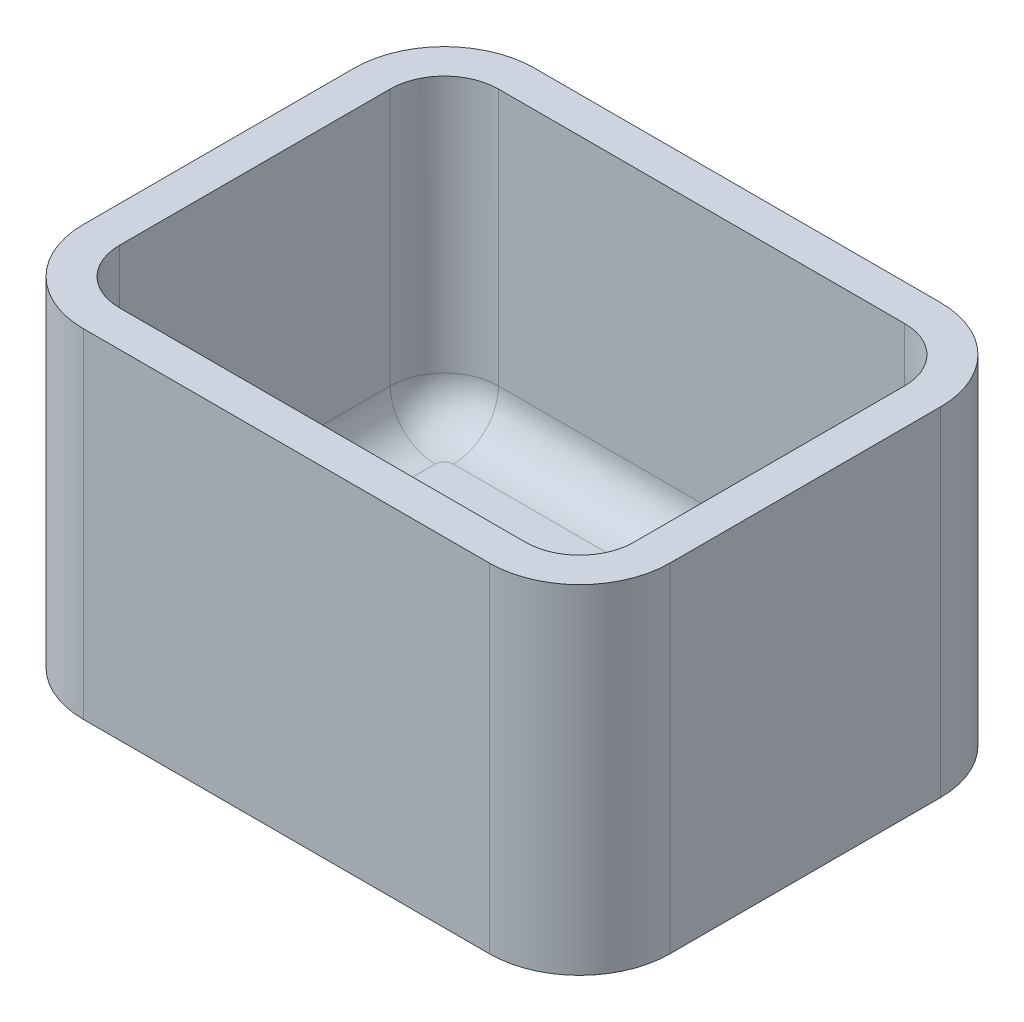
from build123d import *

# Parameters (mm, degrees)
ESQUISSE4_W             = 130
ESQUISSE4_H             = 100
BOSS_EXTRU_4_DEPTH      = 75
CONG_5_R                = 20
ENL_V_MAT_EXTRU_1_DEPTH = 67
CONG_6_SIZE             = 10


with BuildPart() as part:
    # Esquisse4 → Boss.-Extru.4 (new body)
    with BuildSketch(Plane(origin=(0, 0, 0), x_dir=(1, 0, 0), z_dir=(0, 1, 0))):
        with Locations((12.771948074, 16.229726537)):
            Rectangle(ESQUISSE4_W, ESQUISSE4_H)
    extrude(amount=BOSS_EXTRU_4_DEPTH)

    # Congé5
    cong_5_edges = [part.edges().sort_by_distance(p)[0] for p in [
        (-52.228051926, 37.5, -66.229726537),
        (77.771948074, 37.5, -66.229726537),
        (77.771948074, 37.5, 33.770273463),
        (-52.228051926, 37.5, 33.770273463),
    ]]
    fillet(cong_5_edges, radius=CONG_5_R)

    # Esquisse5 → Enlèv. mat.-Extru.1 (cut)
    with BuildSketch(Plane(origin=(0, 75, 0), x_dir=(1, 0, 0), z_dir=(0, 1, 0))):
        with BuildLine():
            Line((57.771948074, 58.229726537), (-32.228051926, 58.229726537))
            ThreePointArc((-32.228051926, 58.229726537), (-40.713333301, 54.715007912), (-44.228051926, 46.229726537))
            Line((-44.228051926, 46.229726537), (-44.228051926, -13.770273463))
            ThreePointArc((-44.228051926, -13.770273463), (-40.713333301, -22.255554837), (-32.228051926, -25.770273463))
            Line((-32.228051926, -25.770273463), (57.771948074, -25.770273463))
            ThreePointArc((57.771948074, -25.770273463), (66.257229448, -22.255554837), (69.771948074, -13.770273463))
            Line((69.771948074, -13.770273463), (69.771948074, 46.229726537))
            ThreePointArc((69.771948074, 46.229726537), (66.257229448, 54.715007912), (57.771948074, 58.229726537))
        make_face()
    extrude(amount=-ENL_V_MAT_EXTRU_1_DEPTH, mode=Mode.SUBTRACT)

    # Congé6
    # a fillet whose section is not a circle: 10 mm, written as the material it adds along each edge
    with BuildSketch(Plane(origin=(57.771948074, 8, -46.229726537), x_dir=(1, 0, 0), z_dir=(0, 0, 1))) as cong_6_piece_1:
        with BuildLine():
            Bezier((12, CONG_6_SIZE), (12, 0), (12 - CONG_6_SIZE, 0), weights=[1, 0.707106781, 1])
            Line((12 - CONG_6_SIZE, 0), (12, 0))
            Line((12, 0), (12, CONG_6_SIZE))
        make_face()
    revolve(axis=Axis((57.771948074, 8, -46.229726537), (0, 1, 0)), revolution_arc=90)
    with BuildSketch(Plane(origin=(69.771948074, 8, 13.770273463), x_dir=(0, 1, 0), z_dir=(0, 0, -1)), Plane(origin=(-44.228051926, 8, -46.229726537), x_dir=(0, 1, 0), z_dir=(0, 0, 1))) as cong_6_piece_2:
        with BuildLine():
            Bezier((CONG_6_SIZE, 0), (0, 0), (0, -CONG_6_SIZE), weights=[1, 0.707106781, 1])
            Line((0, -CONG_6_SIZE), (0, 0))
            Line((0, 0), (CONG_6_SIZE, 0))
        make_face()
    extrude(amount=60)
    with BuildSketch(Plane(origin=(57.771948074, 8, 13.770273463), x_dir=(0, 0, 1), z_dir=(-1, 0, 0))) as cong_6_piece_3:
        with BuildLine():
            Bezier((12, CONG_6_SIZE), (12, 0), (12 - CONG_6_SIZE, 0), weights=[1, 0.707106781, 1])
            Line((12 - CONG_6_SIZE, 0), (12, 0))
            Line((12, 0), (12, CONG_6_SIZE))
        make_face()
    revolve(axis=Axis((57.771948074, 8, 13.770273463), (0, 1, 0)), revolution_arc=90)
    with BuildSketch(Plane(origin=(-32.228051926, 8, 25.770273463), x_dir=(0, 1, 0), z_dir=(1, 0, 0)), Plane(origin=(57.771948074, 8, -58.229726537), x_dir=(0, 1, 0), z_dir=(-1, 0, 0))) as cong_6_piece_4:
        with BuildLine():
            Bezier((CONG_6_SIZE, 0), (0, 0), (0, -CONG_6_SIZE), weights=[1, 0.707106781, 1])
            Line((0, -CONG_6_SIZE), (0, 0))
            Line((0, 0), (CONG_6_SIZE, 0))
        make_face()
    extrude(amount=90)
    with BuildSketch(Plane(origin=(-32.228051926, 8, 13.770273463), x_dir=(-1, 0, 0), z_dir=(0, 0, -1))) as cong_6_piece_5:
        with BuildLine():
            Bezier((12, CONG_6_SIZE), (12, 0), (12 - CONG_6_SIZE, 0), weights=[1, 0.707106781, 1])
            Line((12 - CONG_6_SIZE, 0), (12, 0))
            Line((12, 0), (12, CONG_6_SIZE))
        make_face()
    revolve(axis=Axis((-32.228051926, 8, 13.770273463), (0, 1, 0)), revolution_arc=90)
    with BuildSketch(Plane(origin=(-32.228051926, 8, -46.229726537), x_dir=(0, 0, -1), z_dir=(1, 0, 0))) as cong_6_piece_6:
        with BuildLine():
            Bezier((12, CONG_6_SIZE), (12, 0), (12 - CONG_6_SIZE, 0), weights=[1, 0.707106781, 1])
            Line((12 - CONG_6_SIZE, 0), (12, 0))
            Line((12, 0), (12, CONG_6_SIZE))
        make_face()
    revolve(axis=Axis((-32.228051926, 8, -46.229726537), (0, 1, 0)), revolution_arc=90)


solid = part.part
